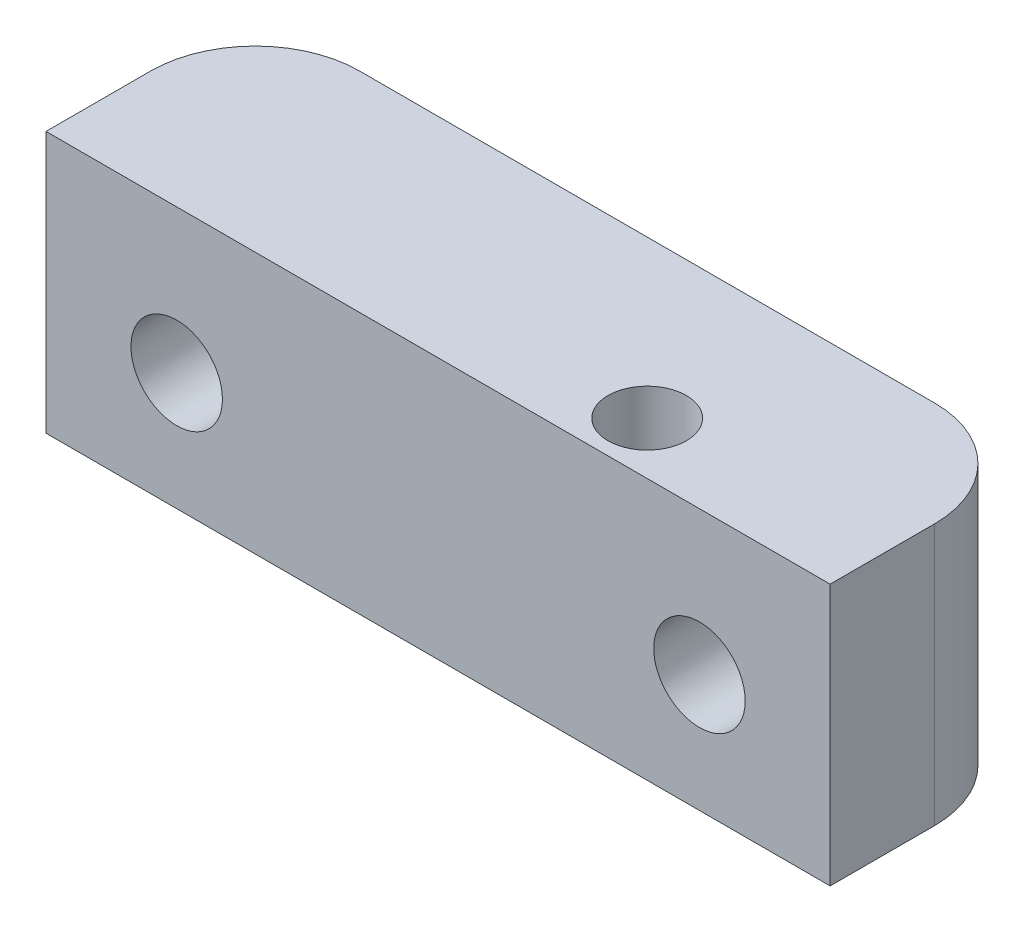
from build123d import *

# Parameters (mm, degrees)
SKETCH1_W           = 30
SKETCH1_H           = 8
SKETCH1_R           = 1.5
BOSS_EXTRUDE1_DEPTH = 2
SKETCH2_R           = 1.75
BOSS_EXTRUDE2_DEPTH = 8
SKETCH4_R           = 1.5
CUT_EXTRUDE2_DEPTH  = 18.464249197
FILLET1_R           = 4


with BuildPart() as part:
    # Sketch1 → Boss-Extrude1 (new body)
    with BuildSketch(Plane(origin=(0, 0, 0), x_dir=(1, 0, 0), z_dir=(0, 1, 0))):
        Rectangle(SKETCH1_W, SKETCH1_H)
        with Locations(Location((6, -2, 0), (0, 0, 270))):
            Circle(SKETCH1_R, mode=Mode.SUBTRACT)
    extrude(amount=BOSS_EXTRUDE1_DEPTH)

    # Sketch2 → Boss-Extrude2 (add)
    with BuildSketch(Plane.XY.offset(4)):
        Polygon((-15, 0), (-15, -8), (15, -8), (15, 0), (5, 0), align=None)
        with Locations((-10, -3.5)):
            Circle(SKETCH2_R, mode=Mode.SUBTRACT)
        with Locations((10, -3.5)):
            Circle(SKETCH2_R, mode=Mode.SUBTRACT)
    extrude(amount=-BOSS_EXTRUDE2_DEPTH)

    # Sketch4 → Cut-Extrude2 (cut, through all)
    with BuildSketch(Plane(origin=(0, 0, 0), x_dir=(1, 0, 0), z_dir=(0, 1, 0))):
        with Locations(Location((6, -2, 0), (0, 0, 270))):
            Circle(SKETCH4_R)
    extrude(amount=-CUT_EXTRUDE2_DEPTH, mode=Mode.SUBTRACT)

    # Fillet1
    # the kernel refuses this fillet: 4 mm, written as the material it takes off along each edge
    with BuildSketch(Plane(origin=(-15, -18, -4), x_dir=(1, 0, 0), z_dir=(0, 1, 0)), Plane(origin=(15, 12, -4), x_dir=(-1, 0, 0), z_dir=(0, -1, 0))) as fillet1_piece_1:
        with BuildLine():
            CenterArc((FILLET1_R, -FILLET1_R), FILLET1_R, 90, 90)
            Line((0, -FILLET1_R), (0, 0))
            Line((0, 0), (FILLET1_R, 0))
        make_face()
    extrude(amount=30, mode=Mode.SUBTRACT)


solid = part.part
